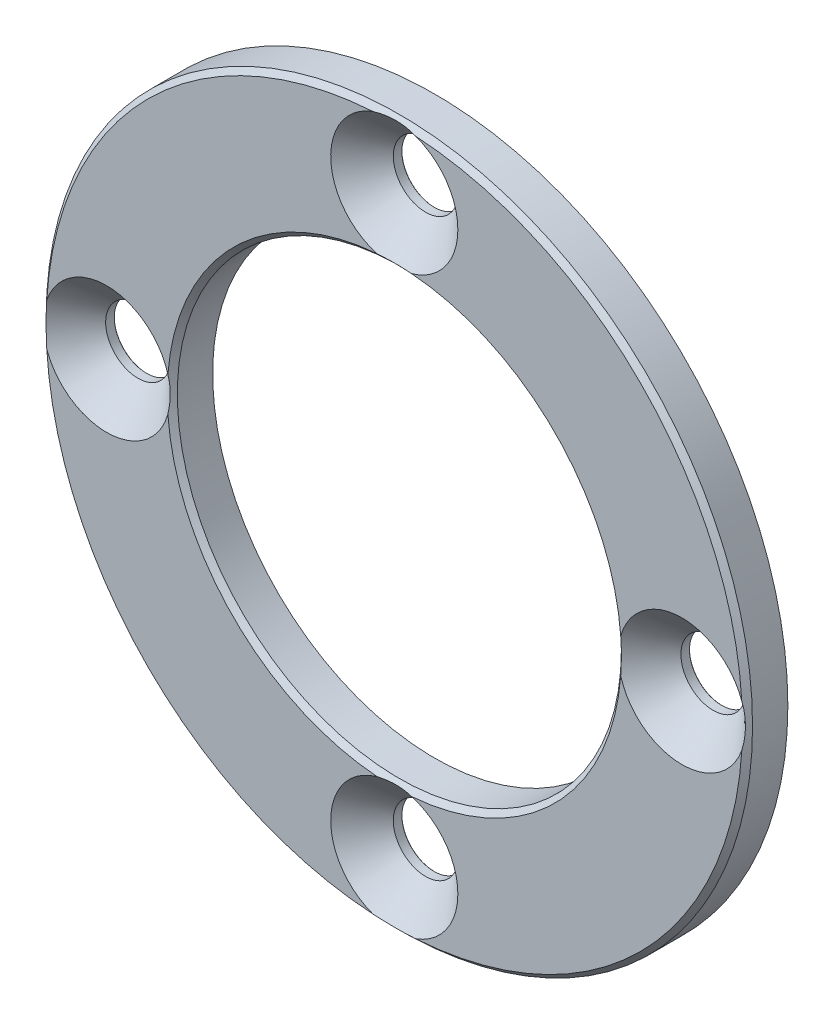
from build123d import *

# Parameters (mm, degrees)
SKETCH_1_R                  = 17.5
SKETCH_1_R_2                = 11
EXTRUDE_1_DEPTH             = 2
HOLE_WIZARD_M3_1_AT_2_COUNT = 2
HOLE_WIZARD_M3_1_AT_2_PITCH = 20.152543264
HOLE_WIZARD_M3_1_AT_3_COUNT = 2
HOLE_WIZARD_M3_1_AT_3_PITCH = 28.5
HOLE_WIZARD_M3_1_AT_4_COUNT = 2
HOLE_WIZARD_M3_1_AT_4_PITCH = 20.152543264
HOLE_WIZARD_M3_1_AT_5_COUNT = 2
HOLE_WIZARD_M3_1_AT_5_PITCH = 14.25
CHAMFER_1_SIZE              = 0.25


with BuildPart() as part:
    # ｽｹｯﾁ1 → ﾎﾞｽ - 押し出し1 (new body)
    with BuildSketch(Plane.XY):
        Circle(SKETCH_1_R)
        Circle(SKETCH_1_R_2, mode=Mode.SUBTRACT)
    extrude(amount=EXTRUDE_1_DEPTH)

    # ｽｹｯﾁ4 → M3 丸皿ねじ用皿穴1 (revolve, cut)
    with BuildSketch(Plane(origin=(0, 14.25, 2), x_dir=(0, -1, 0), z_dir=(1, 0, 0))):
        Polygon((0, 0), (0, 2), (1.625, 2), (1.6, 1.975), (1.6, 1.55), (3.15, 0), align=None)
    hole_wizard_m3_1 = revolve(axis=Axis((0, 14.25, 8.35), (0, 0, -1)), mode=Mode.SUBTRACT)

    # M3 丸皿ねじ用皿穴1 at 2: M3 丸皿ねじ用皿穴1 ×2
    with Locations(*[Vector(0.7071067811865476, -0.7071067811865476, 0) * (i * HOLE_WIZARD_M3_1_AT_2_PITCH) for i in range(1, HOLE_WIZARD_M3_1_AT_2_COUNT)]):
        add(hole_wizard_m3_1, mode=Mode.SUBTRACT)

    # M3 丸皿ねじ用皿穴1 at 3: M3 丸皿ねじ用皿穴1 ×2
    with Locations(*[(0, -i * HOLE_WIZARD_M3_1_AT_3_PITCH, 0) for i in range(1, HOLE_WIZARD_M3_1_AT_3_COUNT)]):
        add(hole_wizard_m3_1, mode=Mode.SUBTRACT)

    # M3 丸皿ねじ用皿穴1 at 4: M3 丸皿ねじ用皿穴1 ×2
    with Locations(*[Vector(-0.7071067811865476, -0.7071067811865476, 0) * (i * HOLE_WIZARD_M3_1_AT_4_PITCH) for i in range(1, HOLE_WIZARD_M3_1_AT_4_COUNT)]):
        add(hole_wizard_m3_1, mode=Mode.SUBTRACT)

    # M3 丸皿ねじ用皿穴1 at 5: M3 丸皿ねじ用皿穴1 ×2
    with Locations(*[(0, -i * HOLE_WIZARD_M3_1_AT_5_PITCH, 0) for i in range(1, HOLE_WIZARD_M3_1_AT_5_COUNT)]):
        add(hole_wizard_m3_1, mode=Mode.SUBTRACT)

    # 面取り1
    # the kernel refuses this chamfer: 0.25 mm, written as the material it takes off along each edge
    with BuildSketch(Plane(origin=(0, 0, 2), x_dir=(1, 0, 0), z_dir=(0, -1, 0))) as chamfer_1_piece_1:
        Polygon((17.5, -CHAMFER_1_SIZE), (17.5 - CHAMFER_1_SIZE, 0), (17.5, 0), align=None)
    revolve(axis=Axis((0, 0, 2), (0, 0, 1)), mode=Mode.SUBTRACT)
    with BuildSketch(Plane(origin=(0, 0, 2), x_dir=(1, 0, 0), z_dir=(0, -1, 0))) as chamfer_1_piece_2:
        Polygon((11 + CHAMFER_1_SIZE, 0), (11, -CHAMFER_1_SIZE), (11, 0), align=None)
    revolve(axis=Axis((0, 0, 2), (0, 0, 1)), mode=Mode.SUBTRACT)


solid = part.part
